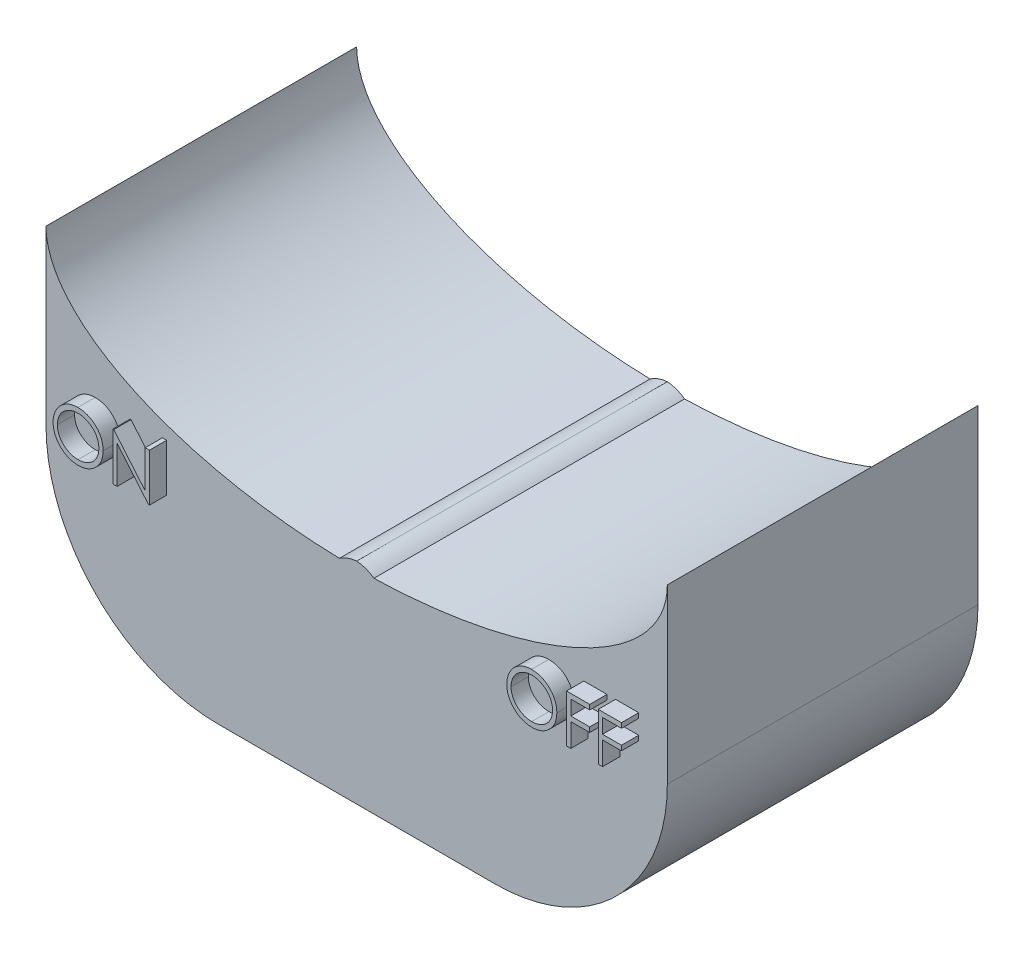
from build123d import *

# Parameters (mm, degrees)
BOSS_EXTRUDE1_DEPTH = 22.86
BOSS_EXTRUDE2_DEPTH = 1.27
FILLET1_R           = 12.7
SKETCH3_W           = 2.54
SKETCH3_H           = 1.27
BOSS_EXTRUDE3_DEPTH = 22.86
FILLET2_R           = 2.54


with BuildPart() as part:
    # Sketch1 → Boss-Extrude1 (new body)
    with BuildSketch(Plane.XY):
        with BuildLine():
            Line((-22.86, 0), (-22.86, -25.4))
            Line((-22.86, -25.4), (22.86, -25.4))
            Line((22.86, -25.4), (22.86, 0))
            add(Edge.make_bspline(
                [(-22.86, 0), (-22.86, -10.390205798), (0, -10.390205798), (22.86, -10.390205798), (22.86, 0)],
                knots=[3.141592654, 3.141592654, 3.141592654, 4.71238898, 4.71238898, 6.283185307, 6.283185307, 6.283185307], degree=2, weights=[1, 0.707106781, 1, 0.707106781, 1]))
        make_face()
    extrude(amount=BOSS_EXTRUDE1_DEPTH)

    # Sketch2 → Boss-Extrude2 (add)
    # profile 1 of 5: a face of its own
    with BuildSketch(Plane.XY.offset(22.86)):
        with BuildLine():
            add(Edge.make_bspline(
                [(-19.249461538, -9.11025641), (-19.184653433, -9.11189789), (-19.057364966, -9.115121891), (-18.870290068, -9.139800994), (-18.691694973, -9.182496384), (-18.520124834, -9.239359367), (-18.357631857, -9.315213752), (-18.202992965, -9.4068989), (-18.056576091, -9.515375359), (-17.920354709, -9.639804586), (-17.795697759, -9.77518804), (-17.685871873, -9.91966595), (-17.593829579, -10.072364752), (-17.518243792, -10.232825583), (-17.458945182, -10.400685551), (-17.418026139, -10.576839554), (-17.391887988, -10.760146244), (-17.388832211, -10.885173108), (-17.387282051, -10.948597756)],
                knots=[0, 0, 0, 0, 1.065120563, 2.091984664, 3.0946048, 4.079830382, 5.057816894, 6.036188127, 7.030412546, 8.04752943, 9.064399622, 10.05169764, 11.02544977, 11.989514704, 12.962713494, 13.945757189, 14.957906945, 16, 16, 16, 16], degree=3))
            add(Edge.make_bspline(
                [(-17.387282051, -10.948597756), (-17.388831984, -11.011555203), (-17.39188708, -11.135651623), (-17.418055858, -11.317795067), (-17.459096858, -11.492885764), (-17.517693124, -11.660631417), (-17.592918603, -11.82120898), (-17.685573774, -11.974195934), (-17.794714984, -12.119642433), (-17.918921835, -12.255955098), (-18.054322877, -12.380952569), (-18.199553144, -12.489871444), (-18.351346464, -12.583595569), (-18.511656172, -12.658379243), (-18.678356209, -12.718151163), (-18.852938532, -12.758903793), (-19.034585086, -12.785190837), (-19.15845609, -12.788209353), (-19.221416667, -12.78974359)],
                knots=[0, 0, 0, 0, 1.043624062, 2.057103931, 3.04512605, 4.022047818, 4.998200453, 5.980619268, 6.982898556, 8.009068085, 9.034988726, 10.034168286, 11.015286542, 11.987931943, 12.962482838, 13.94673481, 14.956375938, 16, 16, 16, 16], degree=3))
            add(Edge.make_bspline(
                [(-19.221416667, -12.78974359), (-19.284840986, -12.788194203), (-19.409867202, -12.785139949), (-19.593404237, -12.758958544), (-19.769681981, -12.71801724), (-19.938196332, -12.659507804), (-20.099041262, -12.583890573), (-20.252531344, -12.491686194), (-20.398050492, -12.382279053), (-20.534392238, -12.258112479), (-20.659141436, -12.122940927), (-20.767900812, -11.978106671), (-20.860125925, -11.826451215), (-20.935489258, -11.667553691), (-20.995153717, -11.502182248), (-21.035858535, -11.329233771), (-21.062194487, -11.149694265), (-21.065229334, -11.027451366), (-21.066769231, -10.965424679)],
                knots=[0, 0, 0, 0, 1.053102029, 2.075944431, 3.073151272, 4.055350789, 5.033113405, 6.020478099, 7.024410459, 8.052272461, 9.079885166, 10.07527673, 11.055994387, 12.023226415, 12.992069828, 13.970394897, 14.97016774, 16, 16, 16, 16], degree=3))
            add(Edge.make_bspline(
                [(-21.066769231, -10.965424679), (-21.066234595, -10.92379201), (-21.065172069, -10.841051887), (-21.052380376, -10.718185287), (-21.033818675, -10.597294629), (-21.007216763, -10.478723681), (-20.972425096, -10.362762696), (-20.931373068, -10.248611933), (-20.881233223, -10.13742821), (-20.824552575, -10.028684818), (-20.761290767, -9.924076912), (-20.691415017, -9.825197329), (-20.617379649, -9.731216332), (-20.536216255, -9.644569328), (-20.45059981, -9.562735672), (-20.359141432, -9.486972955), (-20.262399188, -9.416598004), (-20.159956808, -9.353177663), (-20.054338533, -9.295818528), (-19.945461755, -9.246596677), (-19.834805184, -9.204350616), (-19.721850536, -9.170109791), (-19.606897764, -9.143077755), (-19.489695979, -9.124670401), (-19.370338553, -9.111846083), (-19.289927234, -9.110788581), (-19.249461538, -9.11025641)],
                knots=[0, 0, 0, 0, 1.037015668, 2.060948919, 3.074880161, 4.083647147, 5.086022904, 6.090072063, 7.104153813, 8.122640571, 9.144368836, 10.147691507, 11.138137339, 12.123020368, 13.103399296, 14.087645067, 15.080126199, 16.082011238, 17.087798457, 18.072939717, 19.057185487, 20.037253025, 21.01195951, 21.997135196, 22.992090687, 24, 24, 24, 24], degree=3))
        make_face()
        with BuildLine():
            add(Edge.make_bspline(
                [(-19.234036859, -9.469230769), (-19.267251493, -9.469635659), (-19.333363225, -9.470441569), (-19.431647762, -9.481057285), (-19.528639696, -9.496187174), (-19.624359058, -9.517768695), (-19.718405347, -9.547172747), (-19.811655188, -9.581013655), (-19.903258242, -9.622234746), (-19.9929121, -9.66880745), (-20.079827175, -9.720356371), (-20.161839877, -9.777328138), (-20.239162521, -9.838386693), (-20.311605787, -9.90367453), (-20.378956959, -9.973524132), (-20.442541661, -10.046876568), (-20.499811242, -10.125828459), (-20.552296819, -10.208238866), (-20.59926466, -10.294000447), (-20.641030014, -10.382210309), (-20.675194023, -10.473587996), (-20.703056399, -10.567142154), (-20.72615621, -10.662724613), (-20.740790134, -10.761060462), (-20.751522494, -10.861655574), (-20.752282339, -10.929637428), (-20.752666667, -10.964022436)],
                knots=[0, 0, 0, 0, 1.008559885, 2.007477868, 2.99961109, 3.989939068, 4.984837346, 5.991145699, 7.001802488, 8.033829008, 9.059044045, 10.069351652, 11.065060232, 12.050310815, 13.029377138, 14.011219647, 14.996725999, 15.989392538, 16.977580475, 17.965360261, 18.951710183, 19.937753436, 20.929683414, 21.935841486, 22.955955122, 24, 24, 24, 24], degree=3))
            add(Edge.make_bspline(
                [(-20.752666667, -10.964022436), (-20.751391805, -11.014584657), (-20.748883757, -11.114056187), (-20.726926187, -11.259824331), (-20.693104212, -11.399912617), (-20.643246846, -11.533554526), (-20.580896231, -11.661898809), (-20.503869341, -11.783806914), (-20.412610255, -11.899311788), (-20.308946729, -12.007607057), (-20.195624022, -12.106452862), (-20.075291292, -12.19321627), (-19.949237685, -12.26662652), (-19.817134482, -12.326431592), (-19.679686943, -12.37382133), (-19.536009392, -12.406299961), (-19.387058932, -12.427675417), (-19.285528277, -12.429728173), (-19.234036859, -12.430769231)],
                knots=[0, 0, 0, 0, 1.032063989, 2.030389145, 3.003944642, 3.970395727, 4.937377036, 5.913328081, 6.909231446, 7.93887556, 8.970685674, 9.976071282, 10.964166581, 11.944589148, 12.933237628, 13.927779006, 14.949070134, 16, 16, 16, 16], degree=3))
            add(Edge.make_bspline(
                [(-19.234036859, -12.430769231), (-19.199427357, -12.430293726), (-19.130786321, -12.429350658), (-19.028690799, -12.419851982), (-18.928434587, -12.404620112), (-18.830158307, -12.382689457), (-18.733973496, -12.35524225), (-18.639478693, -12.322634522), (-18.547680402, -12.281953318), (-18.457420564, -12.237005367), (-18.371024323, -12.185765209), (-18.28854879, -12.13072706), (-18.212072811, -12.069758439), (-18.139683739, -12.005440626), (-18.07205605, -11.936476779), (-18.009647066, -11.862956557), (-17.952666934, -11.7844159), (-17.900201287, -11.702130494), (-17.853398024, -11.616134241), (-17.812618925, -11.527604563), (-17.77802281, -11.436759454), (-17.750094305, -11.343467882), (-17.728208843, -11.247907034), (-17.713128923, -11.149948955), (-17.702580484, -11.049789613), (-17.701785407, -10.982045757), (-17.701384615, -10.947896635)],
                knots=[0, 0, 0, 0, 1.047197238, 2.076906641, 3.100256066, 4.114471768, 5.12198147, 6.126382909, 7.136867548, 8.15857795, 9.17633901, 10.174870724, 11.156907918, 12.133735059, 13.104061851, 14.077631395, 15.04955518, 16.038496417, 17.029181396, 18.010275684, 18.986308667, 19.968651475, 20.955262928, 21.950658345, 22.966943676, 24, 24, 24, 24], degree=3))
            add(Edge.make_bspline(
                [(-17.701384615, -10.947896635), (-17.701785728, -10.91398113), (-17.70258141, -10.84670348), (-17.713123884, -10.747242662), (-17.728224775, -10.64998945), (-17.749987483, -10.555325647), (-17.778037637, -10.463227122), (-17.812624967, -10.373780375), (-17.853410266, -10.286652179), (-17.900218491, -10.202057882), (-17.952834314, -10.120883145), (-18.010328558, -10.043280732), (-18.073693906, -9.970707991), (-18.141119931, -9.901373297), (-18.214290816, -9.836755407), (-18.29287511, -9.776832886), (-18.375918788, -9.720159612), (-18.463846023, -9.66903405), (-18.554589977, -9.621819818), (-18.647703935, -9.581368814), (-18.742133035, -9.546996695), (-18.837637147, -9.51767973), (-18.935020125, -9.4962717), (-19.033623954, -9.48104365), (-19.133312213, -9.470445264), (-19.200355432, -9.469636886), (-19.234036859, -9.469230769)],
                knots=[0, 0, 0, 0, 1.02996197, 2.043119294, 3.035359645, 4.018872909, 4.991431989, 5.957985074, 6.929999688, 7.912076566, 8.892894881, 9.867085534, 10.843653904, 11.817741046, 12.803660682, 13.806313499, 14.818574707, 15.856120519, 16.894564902, 17.924820532, 18.937903209, 19.946497019, 20.957711757, 21.963978472, 22.977135795, 24, 24, 24, 24], degree=3))
        make_face(mode=Mode.SUBTRACT)
    # profile 2 of 5: a face of its own
    with BuildSketch(Plane.XY.offset(22.86)):
        Polygon((-16.669333333, -12.7), (-16.669333333, -9.2), (-16.603427885, -9.2), (-14.291128205, -11.954707532), (-14.291128205, -9.2), (-13.977025641, -9.2), (-13.977025641, -12.7), (-14.048540064, -12.7), (-16.355230769, -9.951602564), (-16.355230769, -12.7), align=None)
    # profile 3 of 5: a face of its own
    with BuildSketch(Plane.XY.offset(22.86)):
        with BuildLine():
            add(Edge.make_bspline(
                [(14.135153846, -9.11025641), (14.199961952, -9.11189789), (14.327250419, -9.115121891), (14.514325317, -9.139800994), (14.692920412, -9.182496384), (14.864490551, -9.239359367), (15.026983527, -9.315213752), (15.18162242, -9.4068989), (15.328039294, -9.515375359), (15.464260675, -9.639804586), (15.588917626, -9.77518804), (15.698743512, -9.91966595), (15.790785806, -10.072364752), (15.866371593, -10.232825583), (15.925670202, -10.400685551), (15.966589246, -10.576839554), (15.992727396, -10.760146244), (15.995783174, -10.885173108), (15.997333333, -10.948597756)],
                knots=[0, 0, 0, 0, 1.065120563, 2.091984664, 3.0946048, 4.079830382, 5.057816894, 6.036188127, 7.030412546, 8.04752943, 9.064399622, 10.05169764, 11.02544977, 11.989514704, 12.962713494, 13.945757189, 14.957906945, 16, 16, 16, 16], degree=3))
            add(Edge.make_bspline(
                [(15.997333333, -10.948597756), (15.995783401, -11.011555203), (15.992728304, -11.135651623), (15.966559527, -11.317795067), (15.925518527, -11.492885764), (15.866922261, -11.660631417), (15.791696782, -11.82120898), (15.699041611, -11.974195934), (15.5899004, -12.119642433), (15.465693549, -12.255955098), (15.330292507, -12.380952569), (15.18506224, -12.489871444), (15.03326892, -12.583595569), (14.872959212, -12.658379243), (14.706259175, -12.718151163), (14.531676852, -12.758903793), (14.350030298, -12.785190837), (14.226159295, -12.788209353), (14.163198718, -12.78974359)],
                knots=[0, 0, 0, 0, 1.043624062, 2.057103931, 3.04512605, 4.022047818, 4.998200453, 5.980619268, 6.982898556, 8.009068085, 9.034988726, 10.034168286, 11.015286542, 11.987931943, 12.962482838, 13.94673481, 14.956375938, 16, 16, 16, 16], degree=3))
            add(Edge.make_bspline(
                [(14.163198718, -12.78974359), (14.099774399, -12.788194203), (13.974748183, -12.785139949), (13.791211148, -12.758958544), (13.614933404, -12.71801724), (13.446419053, -12.659507804), (13.285574123, -12.583890573), (13.13208404, -12.491686194), (12.986564893, -12.382279053), (12.850223147, -12.258112479), (12.725473948, -12.122940927), (12.616714573, -11.978106671), (12.524489459, -11.826451215), (12.449126127, -11.667553691), (12.389461668, -11.502182248), (12.348756849, -11.329233771), (12.322420897, -11.149694265), (12.319386051, -11.027451366), (12.317846154, -10.965424679)],
                knots=[0, 0, 0, 0, 1.053102029, 2.075944431, 3.073151272, 4.055350789, 5.033113405, 6.020478099, 7.024410459, 8.052272461, 9.079885166, 10.07527673, 11.055994387, 12.023226415, 12.992069828, 13.970394897, 14.97016774, 16, 16, 16, 16], degree=3))
            add(Edge.make_bspline(
                [(12.317846154, -10.965424679), (12.318380789, -10.92379201), (12.319443316, -10.841051887), (12.332235008, -10.718185287), (12.350796709, -10.597294629), (12.377398622, -10.478723681), (12.412190289, -10.362762696), (12.453242316, -10.248611933), (12.503382162, -10.13742821), (12.56006281, -10.028684818), (12.623324618, -9.924076912), (12.693200367, -9.825197329), (12.767235736, -9.731216332), (12.848399129, -9.644569328), (12.934015574, -9.562735672), (13.025473953, -9.486972955), (13.122216197, -9.416598004), (13.224658577, -9.353177663), (13.330276852, -9.295818528), (13.439153629, -9.246596677), (13.549810201, -9.204350616), (13.662764849, -9.170109791), (13.777717621, -9.143077755), (13.894919405, -9.124670401), (14.014276832, -9.111846083), (14.094688151, -9.110788581), (14.135153846, -9.11025641)],
                knots=[0, 0, 0, 0, 1.037015668, 2.060948919, 3.074880161, 4.083647147, 5.086022904, 6.090072063, 7.104153813, 8.122640571, 9.144368836, 10.147691507, 11.138137339, 12.123020368, 13.103399296, 14.087645067, 15.080126199, 16.082011238, 17.087798457, 18.072939717, 19.057185487, 20.037253025, 21.01195951, 21.997135196, 22.992090687, 24, 24, 24, 24], degree=3))
        make_face()
        with BuildLine():
            add(Edge.make_bspline(
                [(14.150578526, -9.469230769), (14.117363892, -9.469635659), (14.051252159, -9.470441569), (13.952967623, -9.481057285), (13.855975689, -9.496187174), (13.760256327, -9.517768695), (13.666210038, -9.547172747), (13.572960196, -9.581013655), (13.481357142, -9.622234746), (13.391703285, -9.66880745), (13.304788209, -9.720356371), (13.222775508, -9.777328138), (13.145452864, -9.838386693), (13.073009597, -9.90367453), (13.005658425, -9.973524132), (12.942073724, -10.046876568), (12.884804142, -10.125828459), (12.832318565, -10.208238866), (12.785350725, -10.294000447), (12.74358537, -10.382210309), (12.709421362, -10.473587996), (12.681558985, -10.567142154), (12.658459174, -10.662724613), (12.64382525, -10.761060462), (12.633092891, -10.861655574), (12.632333045, -10.929637428), (12.631948718, -10.964022436)],
                knots=[0, 0, 0, 0, 1.008559885, 2.007477868, 2.99961109, 3.989939068, 4.984837346, 5.991145699, 7.001802488, 8.033829008, 9.059044045, 10.069351652, 11.065060232, 12.050310815, 13.029377138, 14.011219647, 14.996725999, 15.989392538, 16.977580475, 17.965360261, 18.951710183, 19.937753436, 20.929683414, 21.935841486, 22.955955122, 24, 24, 24, 24], degree=3))
            add(Edge.make_bspline(
                [(12.631948718, -10.964022436), (12.63322358, -11.014584657), (12.635731628, -11.114056187), (12.657689198, -11.259824331), (12.691511172, -11.399912617), (12.741368539, -11.533554526), (12.803719153, -11.661898809), (12.880746044, -11.783806914), (12.972005129, -11.899311788), (13.075668656, -12.007607057), (13.188991362, -12.106452862), (13.309324092, -12.19321627), (13.4353777, -12.26662652), (13.567480903, -12.326431592), (13.704928442, -12.37382133), (13.848605993, -12.406299961), (13.997556452, -12.427675417), (14.099087107, -12.429728173), (14.150578526, -12.430769231)],
                knots=[0, 0, 0, 0, 1.032063989, 2.030389145, 3.003944642, 3.970395727, 4.937377036, 5.913328081, 6.909231446, 7.93887556, 8.970685674, 9.976071282, 10.964166581, 11.944589148, 12.933237628, 13.927779006, 14.949070134, 16, 16, 16, 16], degree=3))
            add(Edge.make_bspline(
                [(14.150578526, -12.430769231), (14.185188027, -12.430293726), (14.253829064, -12.429350658), (14.355924586, -12.419851982), (14.456180798, -12.404620112), (14.554457078, -12.382689457), (14.650641889, -12.35524225), (14.745136692, -12.322634522), (14.836934982, -12.281953318), (14.92719482, -12.237005367), (15.013591062, -12.185765209), (15.096066594, -12.13072706), (15.172542574, -12.069758439), (15.244931645, -12.005440626), (15.312559334, -11.936476779), (15.374968319, -11.862956557), (15.431948451, -11.7844159), (15.484414097, -11.702130494), (15.53121736, -11.616134241), (15.571996459, -11.527604563), (15.606592575, -11.436759454), (15.63452108, -11.343467882), (15.656406542, -11.247907034), (15.671486462, -11.149948955), (15.6820349, -11.049789613), (15.682829977, -10.982045757), (15.683230769, -10.947896635)],
                knots=[0, 0, 0, 0, 1.047197238, 2.076906641, 3.100256066, 4.114471768, 5.12198147, 6.126382909, 7.136867548, 8.15857795, 9.17633901, 10.174870724, 11.156907918, 12.133735059, 13.104061851, 14.077631395, 15.04955518, 16.038496417, 17.029181396, 18.010275684, 18.986308667, 19.968651475, 20.955262928, 21.950658345, 22.966943676, 24, 24, 24, 24], degree=3))
            add(Edge.make_bspline(
                [(15.683230769, -10.947896635), (15.682829656, -10.91398113), (15.682033975, -10.84670348), (15.6714915, -10.747242662), (15.65639061, -10.64998945), (15.634627902, -10.555325647), (15.606577748, -10.463227122), (15.571990418, -10.373780375), (15.531205118, -10.286652179), (15.484396894, -10.202057882), (15.43178107, -10.120883145), (15.374286827, -10.043280732), (15.310921479, -9.970707991), (15.243495454, -9.901373297), (15.170324569, -9.836755407), (15.091740275, -9.776832886), (15.008696597, -9.720159612), (14.920769361, -9.66903405), (14.830025408, -9.621819818), (14.73691145, -9.581368814), (14.64248235, -9.546996695), (14.546978238, -9.51767973), (14.449595259, -9.4962717), (14.350991431, -9.48104365), (14.251303172, -9.470445264), (14.184259952, -9.469636886), (14.150578526, -9.469230769)],
                knots=[0, 0, 0, 0, 1.02996197, 2.043119294, 3.035359645, 4.018872909, 4.991431989, 5.957985074, 6.929999688, 7.912076566, 8.892894881, 9.867085534, 10.843653904, 11.817741046, 12.803660682, 13.806313499, 14.818574707, 15.856120519, 16.894564902, 17.924820532, 18.937903209, 19.946497019, 20.957711757, 21.963978472, 22.977135795, 24, 24, 24, 24], degree=3))
        make_face(mode=Mode.SUBTRACT)
    # profile 4 of 5: a face of its own
    with BuildSketch(Plane.XY.offset(22.86)):
        Polygon((16.715282051, -9.2), (18.420410256, -9.2), (18.420410256, -9.558974359), (17.029384615, -9.558974359), (17.029384615, -10.635897436), (18.420410256, -10.635897436), (18.420410256, -10.994871795), (17.029384615, -10.994871795), (17.029384615, -12.7), (16.715282051, -12.7), align=None)
    # profile 5 of 5: a face of its own
    with BuildSketch(Plane.XY.offset(22.86)):
        Polygon((19.048615385, -9.2), (20.75374359, -9.2), (20.75374359, -9.558974359), (19.362717949, -9.558974359), (19.362717949, -10.635897436), (20.75374359, -10.635897436), (20.75374359, -10.994871795), (19.362717949, -10.994871795), (19.362717949, -12.7), (19.048615385, -12.7), align=None)
    extrude(amount=BOSS_EXTRUDE2_DEPTH)

    # Fillet1
    fillet1_edges = [part.edges().sort_by_distance(p)[0] for p in [
        (22.86, -25.4, 11.43),
        (-22.86, -25.4, 11.43),
    ]]
    fillet(fillet1_edges, radius=FILLET1_R)

    # Sketch3 → Boss-Extrude3 (add)
    with BuildSketch(Plane(origin=(0, 0, 0), x_dir=(-1, 0, 0), z_dir=(0, 0, -1))):
        with Locations((0, -10.541)):
            Rectangle(SKETCH3_W, SKETCH3_H)
    extrude(amount=-BOSS_EXTRUDE3_DEPTH)

    # Fillet2
    # the kernel refuses this fillet: 2.54 mm, written as the material it takes off along each edge
    with BuildSketch(Plane(origin=(-1.27, -9.906, -3.67344818), x_dir=(0, -1, 0), z_dir=(0, 0, 1))) as fillet2_piece_1:
        with BuildLine():
            CenterArc((2.54, 1.469379272), FILLET2_R, 180, 35.344812964)
            Line((0, 1.469379272), (-0.0508, 1.469379272))
            Line((-0.0508, 1.469379272), (-0.0508, 0))
            Line((-0.0508, 0), (0, -0.0508))
            ThreePointArc((0, -0.0508), (0.234079569, -0.0508), (0.426722321, -0.029387585))
            Line((0.426722321, -0.029387585), (0.468159139, 0))
        make_face()
    extrude(amount=30.206896359, mode=Mode.SUBTRACT)
    with BuildSketch(Plane(origin=(1.27, -9.906, -3.67344818), x_dir=(0, -1, 0), z_dir=(0, 0, 1))) as fillet2_piece_2:
        with BuildLine():
            CenterArc((2.54, -1.469379272), FILLET2_R, 144.655187036, 35.344812964)
            Line((0, -1.469379272), (-0.0508, -1.469379272))
            Line((-0.0508, -1.469379272), (-0.0508, 0))
            Line((-0.0508, 0), (0, 0.0508))
            ThreePointArc((0, 0.0508), (0.234079569, 0.0508), (0.426722321, 0.029387585))
            Line((0.426722321, 0.029387585), (0.468159139, 0))
        make_face()
    extrude(amount=30.206896359, mode=Mode.SUBTRACT)


solid = part.part
